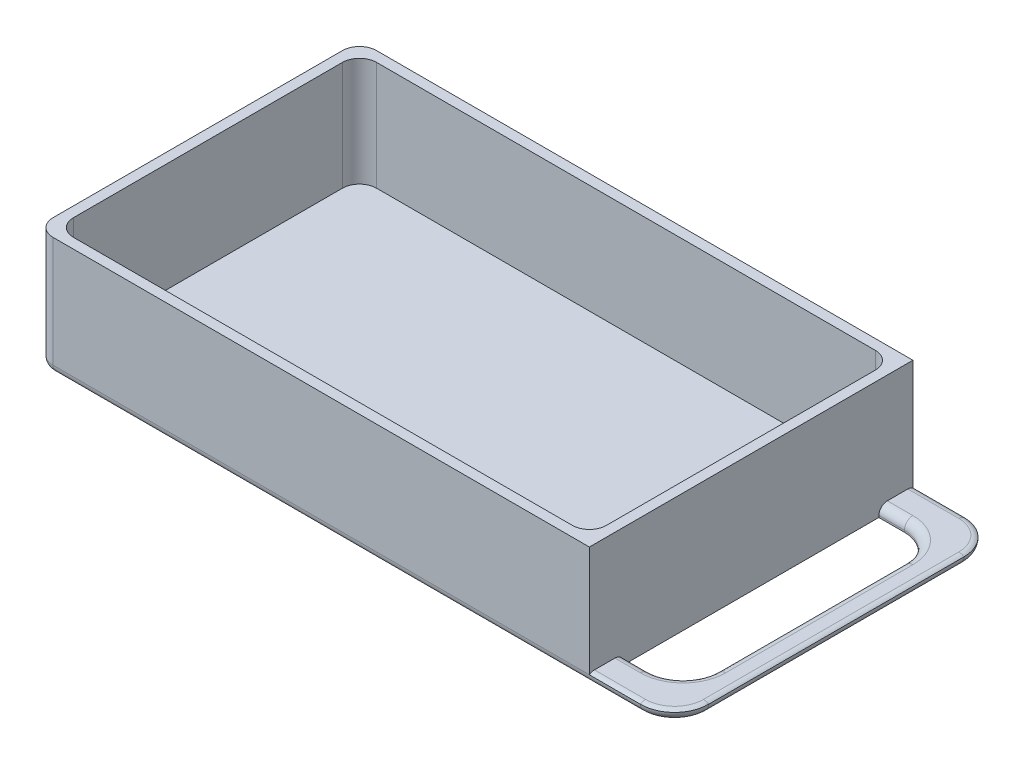
from build123d import *

# Parameters (mm, degrees)
SKETCH_1_W          = 75
SKETCH_1_H          = 38
EXTRUDE_1_DEPTH     = 14
SKETCH_2_W          = 10
SKETCH_2_H          = 38
CUT_EXTRUDE_1_DEPTH = 12.8
SKETCH_3_W          = 7
SKETCH_3_H          = 30
CUT_EXTRUDE_2_DEPTH = 1.2
FILLET_2_R          = 4
SKETCH_5_W          = 62.6
SKETCH_5_H          = 35.6
CUT_EXTRUDE_4_DEPTH = 12.8
FILLET_3_R          = 2
FILLET_4_R          = 2
FILLET_6_R          = 1
FILLET_7_R          = 1
FILLET_8_R          = 1


with BuildPart() as part:
    # Эскиз1 → Бобышка-Вытянуть1 (new body)
    with BuildSketch(Plane(origin=(0, 0, 0), x_dir=(1, 0, 0), z_dir=(0, 1, 0))):
        with Locations((37.5, 19)):
            Rectangle(SKETCH_1_W, SKETCH_1_H)
    extrude(amount=EXTRUDE_1_DEPTH)

    # Эскиз2 → Вырез-Вытянуть1 (cut)
    with BuildSketch(Plane(origin=(0, 14, 0), x_dir=(1, 0, 0), z_dir=(0, 1, 0))):
        with Locations((70, 19)):
            Rectangle(SKETCH_2_W, SKETCH_2_H)
    extrude(amount=-CUT_EXTRUDE_1_DEPTH, mode=Mode.SUBTRACT)

    # Эскиз3 → Вырез-Вытянуть2 (cut)
    with BuildSketch(Plane(origin=(0, 1.2, 0), x_dir=(1, 0, 0), z_dir=(0, 1, 0))):
        with Locations((68.5, 19)):
            Rectangle(SKETCH_3_W, SKETCH_3_H)
    extrude(amount=-CUT_EXTRUDE_2_DEPTH, mode=Mode.SUBTRACT)

    # Скругление2
    fillet_2_edges = [part.edges().sort_by_distance(p)[0] for p in [
        (75, 0.6, -38),
        (75, 0.6, 0),
        (72, 0.6, -34),
        (72, 0.6, -4),
    ]]
    fillet(fillet_2_edges, radius=FILLET_2_R)

    # Эскиз5 → Вырез-Вытянуть4 (cut)
    with BuildSketch(Plane(origin=(0, 14, 0), x_dir=(1, 0, 0), z_dir=(0, 1, 0))):
        with Locations((32.5, 19)):
            Rectangle(SKETCH_5_W, SKETCH_5_H)
    extrude(amount=-CUT_EXTRUDE_4_DEPTH, mode=Mode.SUBTRACT)

    # Скругление3
    fillet_3_edges = [part.edges().sort_by_distance(p)[0] for p in [
        (0, 7, -38),
        (0, 7, 0),
    ]]
    fillet(fillet_3_edges, radius=FILLET_3_R)

    # Скругление4
    fillet_4_edges = [part.edges().sort_by_distance(p)[0] for p in [
        (1.2, 7.6, -1.2),
        (1.2, 7.6, -36.8),
        (63.8, 7.6, -36.8),
        (63.8, 7.6, -1.2),
    ]]
    fillet(fillet_4_edges, radius=FILLET_4_R)

    # Скругление6
    fillet_6_edges = [part.edges().sort_by_distance(p)[0] for p in [
        (36.5, 0, -38),
        (75, 0, -19),
        (73.828427125, 0, -1.171572875),
        (73.828427125, 0, -36.828427125),
        (0, 0, -19),
        (36.5, 0, 0),
        (0.585786438, 0, -0.585786438),
        (0.585786438, 0, -37.414213562),
    ]]
    fillet(fillet_6_edges, radius=FILLET_6_R)

    # Скругление7
    fillet_7_edges = [part.edges().sort_by_distance(p)[0] for p in [
        (66.5, 1.2, -4),
        (72, 1.2, -19),
        (66.5, 1.2, -34),
        (70.828427125, 1.2, -5.171572875),
        (70.828427125, 1.2, -32.828427125),
    ]]
    fillet(fillet_7_edges, radius=FILLET_7_R)

    # Скругление8
    # the kernel refuses this fillet: 1 mm, written as the material it takes off along each edge
    with BuildSketch(Plane(origin=(71, 1.2, -38), x_dir=(0, 0, 1), z_dir=(-1, 0, 0)), Plane(origin=(65, 1.2, 0), x_dir=(0, 0, -1), z_dir=(1, 0, 0))) as fillet_8_piece_1:
        with BuildLine():
            CenterArc((0.6, -1), FILLET_8_R, 90, 36.869897646)
            Line((0, -0.2), (-0.012, -0.184))
            ThreePointArc((-0.012, -0.184), (-0.02, -0.1), (-0.02, 0))
            Line((-0.02, 0), (0, 0.02))
            Line((0, 0.02), (0.6, 0.02))
            Line((0.6, 0.02), (0.6, 0))
        make_face()
    extrude(amount=6, mode=Mode.SUBTRACT)
    with BuildSketch(Plane(origin=(71, 1.2, -34), x_dir=(1, 0, 0), z_dir=(0, 0, 1))) as fillet_8_piece_2:
        with BuildLine():
            CenterArc((3.4, -1), FILLET_8_R, 53.130102354, 36.869897646)
            Line((4, -0.2), (4.012, -0.184))
            ThreePointArc((4.012, -0.184), (4.02, -0.1), (4.02, 0))
            Line((4.02, 0), (4, 0.02))
            Line((4, 0.02), (3.4, 0.02))
            Line((3.4, 0.02), (3.4, 0))
        make_face()
    revolve(axis=Axis((71, 1.2, -34), (0, 1, 0)), revolution_arc=90, mode=Mode.SUBTRACT)
    with BuildSketch(Plane(origin=(75, 1.2, -4), x_dir=(-1, 0, 0), z_dir=(0, 0, -1))) as fillet_8_piece_3:
        with BuildLine():
            CenterArc((0.6, -1), FILLET_8_R, 90, 36.869897646)
            Line((0, -0.2), (-0.012, -0.184))
            ThreePointArc((-0.012, -0.184), (-0.02, -0.1), (-0.02, 0))
            Line((-0.02, 0), (0, 0.02))
            Line((0, 0.02), (0.6, 0.02))
            Line((0.6, 0.02), (0.6, 0))
        make_face()
    extrude(amount=30, mode=Mode.SUBTRACT)
    with BuildSketch(Plane(origin=(71, 1.2, -4), x_dir=(0, 0, 1), z_dir=(-1, 0, 0))) as fillet_8_piece_4:
        with BuildLine():
            CenterArc((3.4, -1), FILLET_8_R, 53.130102354, 36.869897646)
            Line((4, -0.2), (4.012, -0.184))
            ThreePointArc((4.012, -0.184), (4.02, -0.1), (4.02, 0))
            Line((4.02, 0), (4, 0.02))
            Line((4, 0.02), (3.4, 0.02))
            Line((3.4, 0.02), (3.4, 0))
        make_face()
    revolve(axis=Axis((71, 1.2, -4), (0, 1, 0)), revolution_arc=90, mode=Mode.SUBTRACT)


solid = part.part
